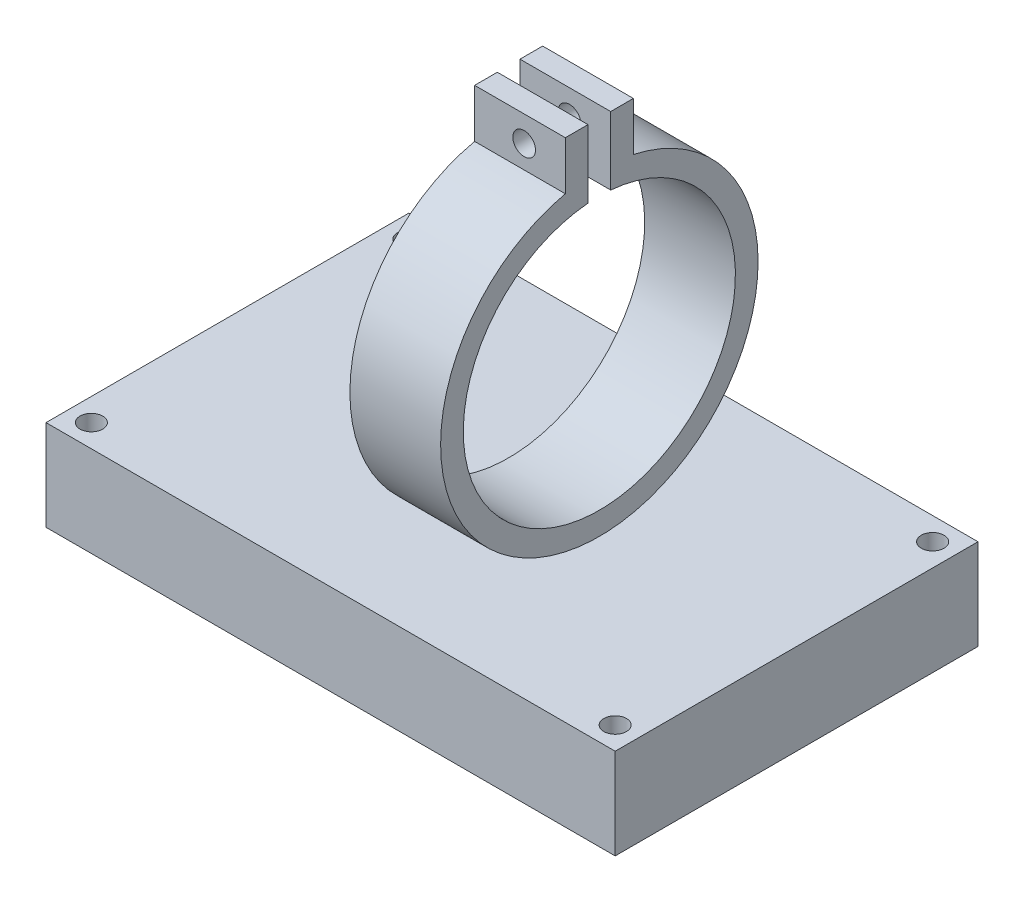
from build123d import *

# Parameters (mm, degrees)
SKETCH1_W           = 125.5
SKETCH1_H           = 80
SKETCH1_R           = 2.5
BOSS_EXTRUDE1_DEPTH = 20
BOSS_EXTRUDE2_DEPTH = 20
SKETCH3_W           = 5
SKETCH3_H           = 15
BOSS_EXTRUDE3_DEPTH = 20
SKETCH4_R           = 2.5
CUT_EXTRUDE1_DEPTH  = 100


with BuildPart() as part:
    # Sketch1 → Boss-Extrude1 (new body)
    with BuildSketch(Plane(origin=(0, 0, 0), x_dir=(1, 0, 0), z_dir=(0, 1, 0))):
        Rectangle(SKETCH1_W, SKETCH1_H)
        with Locations((-57.75, 35)):
            Circle(SKETCH1_R, mode=Mode.SUBTRACT)
        with Locations((-57.75, -35)):
            Circle(SKETCH1_R, mode=Mode.SUBTRACT)
        with Locations((57.75, 35)):
            Circle(SKETCH1_R, mode=Mode.SUBTRACT)
        with Locations((57.75, -35)):
            Circle(SKETCH1_R, mode=Mode.SUBTRACT)
    extrude(amount=BOSS_EXTRUDE1_DEPTH)


with BuildPart() as body_2:
    # Sketch2 → Boss-Extrude2 (new body)
    with BuildSketch(Plane(origin=(0, 0, 0), x_dir=(0, 0, -1), z_dir=(1, 0, 0))):
        with BuildLine():
            Line((-3.237992806, 84.895651858), (-3.237992806, 89.910600109))
            ThreePointArc((-3.237992806, 89.910600109), (-0.737992806, 20), (1.762007194, 89.910600109))
            Line((1.762007194, 89.910600109), (1.762007194, 84.895651858))
            ThreePointArc((1.762007194, 84.895651858), (-0.737992806, 25), (-3.237992806, 84.895651858))
        make_face()
    extrude(amount=BOSS_EXTRUDE2_DEPTH)

    # Sketch3 → Boss-Extrude3 (add)
    with BuildSketch(Plane(origin=(20, 0, 0), x_dir=(0, 0, -1), z_dir=(1, 0, 0))):
        with Locations((4.262007194, 92.395651858)):
            Rectangle(SKETCH3_W, SKETCH3_H)
        with Locations((-5.737992806, 92.395651858)):
            Rectangle(SKETCH3_W, SKETCH3_H)
    extrude(amount=-BOSS_EXTRUDE3_DEPTH)

    # Sketch4 → Cut-Extrude1 (cut)
    with BuildSketch(Plane.XY.offset(8.237992806)):
        with Locations((10.919770462, 94.232950225)):
            Circle(SKETCH4_R)
    extrude(amount=-CUT_EXTRUDE1_DEPTH, mode=Mode.SUBTRACT)


solid = Compound([part.part, body_2.part])
